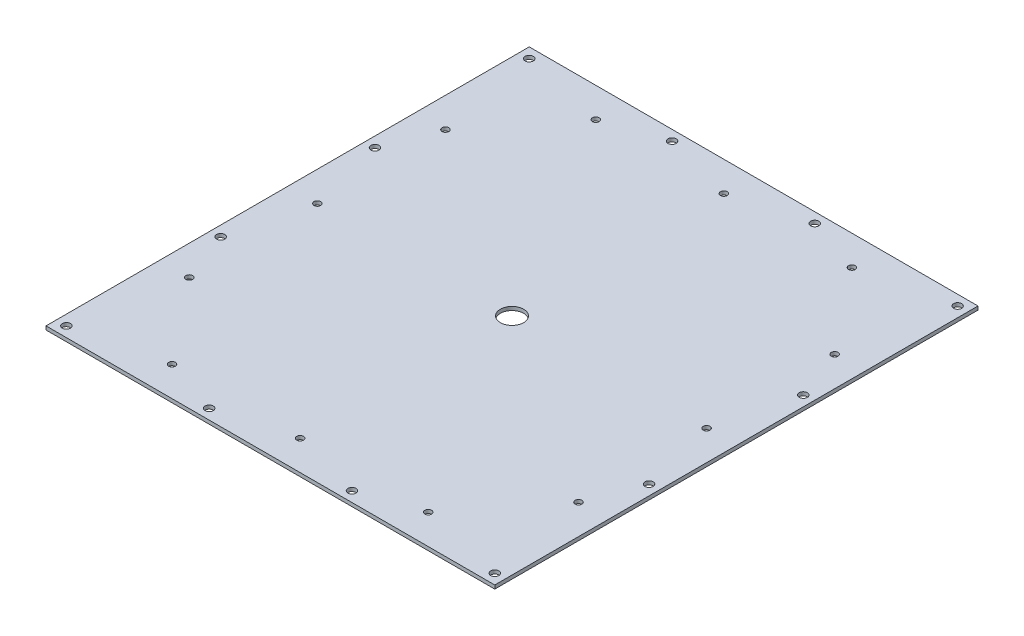
from build123d import *

# Parameters (mm, degrees)
SKETCH2_W           = 195.7832
SKETCH2_H           = 210.82
SKETCH2_R           = 1.778
SKETCH2_R_2         = 1.4732
SKETCH2_R_3         = 5.08
BOSS_EXTRUDE1_DEPTH = 1.5748


with BuildPart() as part:
    # Sketch2 → Boss-Extrude1 (new body)
    with BuildSketch(Plane(origin=(0, 0, 0), x_dir=(1, 0, 0), z_dir=(0, 1, 0))):
        with Locations((89.0016, 96.52)):
            Rectangle(SKETCH2_W, SKETCH2_H)
        with Locations((-4.445, -4.445)):
            Circle(SKETCH2_R, mode=Mode.SUBTRACT)
        with Locations((-4.445, 197.485)):
            Circle(SKETCH2_R, mode=Mode.SUBTRACT)
        with Locations((-4.445, 62.865)):
            Circle(SKETCH2_R, mode=Mode.SUBTRACT)
        with Locations((-4.445, 130.175)):
            Circle(SKETCH2_R, mode=Mode.SUBTRACT)
        with Locations((57.8612, 197.485)):
            Circle(SKETCH2_R, mode=Mode.SUBTRACT)
        with Locations((120.142, 197.485)):
            Circle(SKETCH2_R, mode=Mode.SUBTRACT)
        with Locations((57.8612, -4.445)):
            Circle(SKETCH2_R, mode=Mode.SUBTRACT)
        with Locations((120.142, -4.445)):
            Circle(SKETCH2_R, mode=Mode.SUBTRACT)
        with Locations((182.4482, -4.445)):
            Circle(SKETCH2_R, mode=Mode.SUBTRACT)
        with Locations((182.4482, 197.485)):
            Circle(SKETCH2_R, mode=Mode.SUBTRACT)
        with Locations((182.4482, 62.865)):
            Circle(SKETCH2_R, mode=Mode.SUBTRACT)
        with Locations((182.4482, 130.175)):
            Circle(SKETCH2_R, mode=Mode.SUBTRACT)
        with Locations((33.1216, 4.0894)):
            Circle(SKETCH2_R_2, mode=Mode.SUBTRACT)
        with Locations((89.0016, 4.0894)):
            Circle(SKETCH2_R_2, mode=Mode.SUBTRACT)
        with Locations((144.8816, 4.0894)):
            Circle(SKETCH2_R_2, mode=Mode.SUBTRACT)
        with Locations((33.1216, 188.9506)):
            Circle(SKETCH2_R_2, mode=Mode.SUBTRACT)
        with Locations((89.0016, 188.9506)):
            Circle(SKETCH2_R_2, mode=Mode.SUBTRACT)
        with Locations((144.8816, 188.9506)):
            Circle(SKETCH2_R_2, mode=Mode.SUBTRACT)
        with Locations((4.0894, 40.64)):
            Circle(SKETCH2_R_2, mode=Mode.SUBTRACT)
        with Locations((4.0894, 96.52)):
            Circle(SKETCH2_R_2, mode=Mode.SUBTRACT)
        with Locations((4.0894, 152.4)):
            Circle(SKETCH2_R_2, mode=Mode.SUBTRACT)
        with Locations((173.8884, 40.64)):
            Circle(SKETCH2_R_2, mode=Mode.SUBTRACT)
        with Locations((173.8884, 96.52)):
            Circle(SKETCH2_R_2, mode=Mode.SUBTRACT)
        with Locations((173.8884, 152.4)):
            Circle(SKETCH2_R_2, mode=Mode.SUBTRACT)
        with Locations((89.0016, 96.52)):
            Circle(SKETCH2_R_3, mode=Mode.SUBTRACT)
    extrude(amount=BOSS_EXTRUDE1_DEPTH)


solid = part.part
